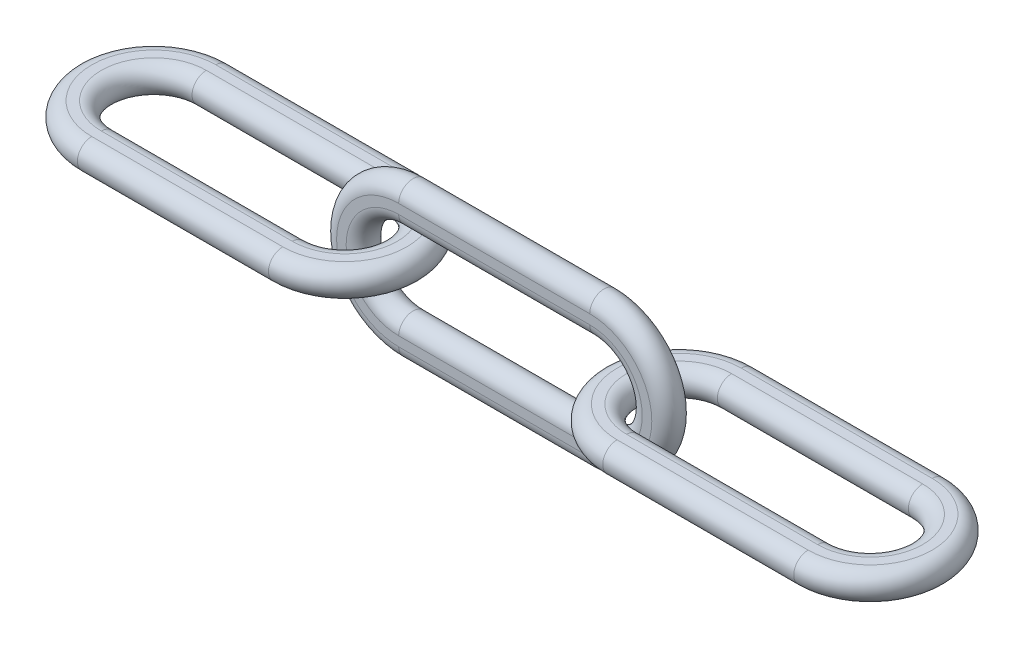
from build123d import *

# Parameters (mm, degrees)
ESTRUSIONE_ESTRUSIONE1_DEPTH = 1.5
RACCORDO9_R                  = 0.75
RACCORDO13_R                 = 0.75
ESTRUSIONE_ESTRUSIONE2_DEPTH = 0.75
RACCORDO16_R                 = 0.75
RACCORDO17_R                 = 0.75
RIPETIZIONE_A_L2_COUNT       = 2
RIPETIZIONE_A_L2_PITCH       = 27.5


with BuildPart() as part:
    # Schizzo1 → Estrusione-Estrusione1 (new body)
    with BuildSketch(Plane(origin=(0, 0, 0), x_dir=(1, 0, 0), z_dir=(0, 1, 0))):
        with BuildLine():
            Line((-7.06089646, 4), (2.93910354, 4))
            ThreePointArc((2.93910354, 4), (6.93910354, 0), (2.93910354, -4))
            Line((2.93910354, -4), (-7.06089646, -4))
            ThreePointArc((-7.06089646, -4), (-11.06089646, 0), (-7.06089646, 4))
        make_face()
        with BuildLine():
            Line((-7.06089646, 2), (2.93910354, 2))
            ThreePointArc((2.93910354, 2), (4.93910354, 0), (2.93910354, -2))
            Line((2.93910354, -2), (-7.06089646, -2))
            ThreePointArc((-7.06089646, -2), (-9.06089646, 0), (-7.06089646, 2))
        make_face(mode=Mode.SUBTRACT)
    extrude(amount=ESTRUSIONE_ESTRUSIONE1_DEPTH)

    # Raccordo9
    raccordo9_edges = [part.edges().sort_by_distance(p)[0] for p in [
        (6.93910354, 1.5, 0),
        (-2.06089646, 1.5, -4),
        (-11.06089646, 1.5, 0),
        (-2.06089646, 0, -4),
        (-2.06089646, 0, 4),
        (-2.06089646, 1.5, 4),
    ]]
    fillet(raccordo9_edges, radius=RACCORDO9_R - 0.0001)  # a hair under: the kernel refuses the full size

    # Raccordo13
    raccordo13_edges = [part.edges().sort_by_distance(p)[0] for p in [
        (-9.06089646, 0, 0),
        (-2.06089646, 0, 2),
        (4.93910354, 0, 0),
        (-2.06089646, 0, -2),
        (-2.06089646, 1.5, 2),
        (-2.06089646, 1.5, -2),
    ]]
    fillet(raccordo13_edges, radius=RACCORDO13_R - 0.0001)  # a hair under: the kernel refuses the full size


with BuildPart() as body_2:
    # Schizzo3 → Estrusione-Estrusione2 (new, symmetric)
    with BuildSketch(Plane.XY):
        with BuildLine():
            Line((6.5070567, 4.75), (16.5070567, 4.75))
            ThreePointArc((16.5070567, 4.75), (20.5070567, 0.75), (16.5070567, -3.25))
            Line((16.5070567, -3.25), (6.5070567, -3.25))
            ThreePointArc((6.5070567, -3.25), (2.5070567, 0.75), (6.5070567, 4.75))
        make_face()
        with BuildLine():
            Line((6.5070567, 2.75), (16.5070567, 2.75))
            ThreePointArc((16.5070567, 2.75), (18.5070567, 0.75), (16.5070567, -1.25))
            Line((16.5070567, -1.25), (6.5070567, -1.25))
            ThreePointArc((6.5070567, -1.25), (4.5070567, 0.75), (6.5070567, 2.75))
        make_face(mode=Mode.SUBTRACT)
    extrude(amount=ESTRUSIONE_ESTRUSIONE2_DEPTH, both=True)

    # Raccordo16
    raccordo16_edges = [body_2.edges().sort_by_distance(p)[0] for p in [
        (20.5070567, 0.75, 0.75),
        (11.5070567, 4.75, 0.75),
        (2.5070567, 0.75, 0.75),
        (11.5070567, 4.75, -0.75),
        (11.5070567, -3.25, -0.75),
        (11.5070567, -3.25, 0.75),
    ]]
    fillet(raccordo16_edges, radius=RACCORDO16_R - 0.0001)  # a hair under: the kernel refuses the full size

    # Raccordo17
    raccordo17_edges = [body_2.edges().sort_by_distance(p)[0] for p in [
        (4.5070567, 0.75, -0.75),
        (11.5070567, -1.25, -0.75),
        (18.5070567, 0.75, -0.75),
        (11.5070567, 2.75, -0.75),
        (11.5070567, -1.25, 0.75),
        (11.5070567, 2.75, 0.75),
    ]]
    fillet(raccordo17_edges, radius=RACCORDO17_R - 0.0001)  # a hair under: the kernel refuses the full size


with BuildPart() as ripetizione_a_l2_1:
    # Ripetizione a L2: pattern copy
    add(part.part.moved(Location(Vector(1, 0, 0) * (1 * RIPETIZIONE_A_L2_PITCH))))


solid = Compound([part.part, body_2.part, ripetizione_a_l2_1.part])
